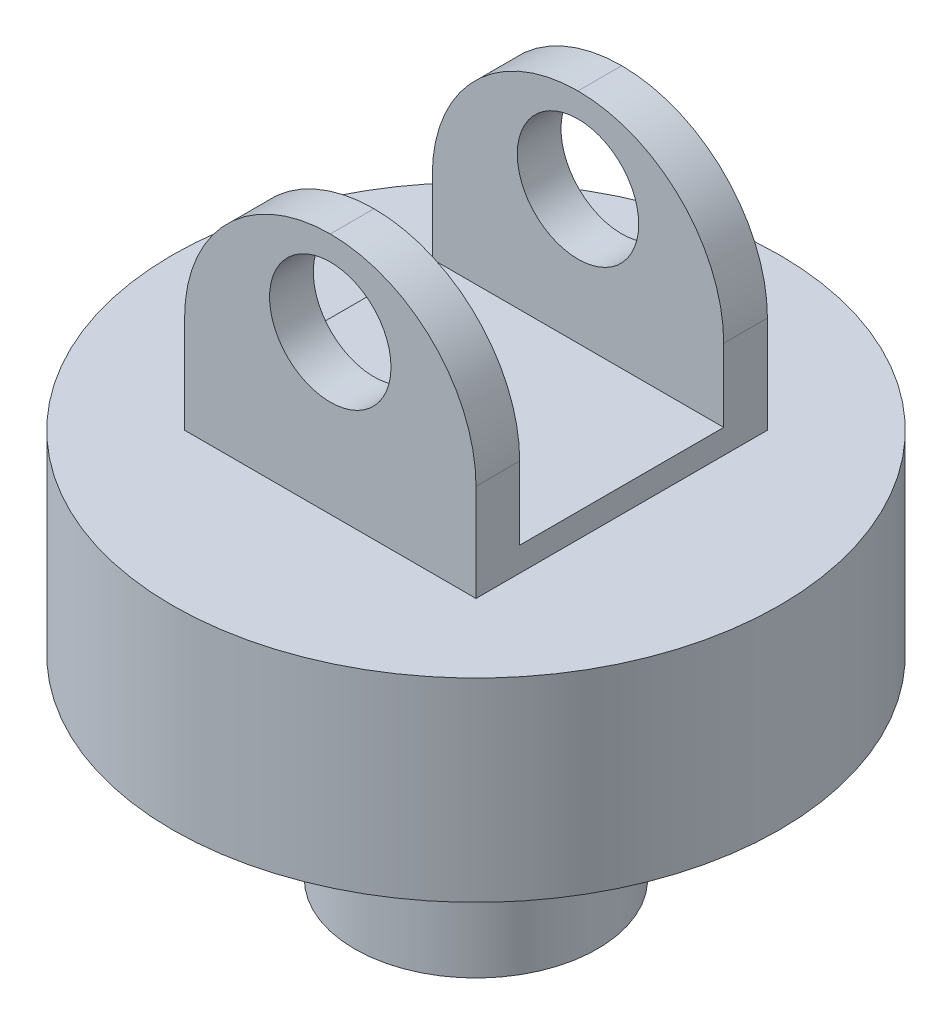
from build123d import *

# Parameters (mm, degrees)
SKETCH1_R           = 125
BOSS_EXTRUDE1_DEPTH = 80
SKETCH2_R           = 50
BOSS_EXTRUDE2_DEPTH = 160
SKETCH3_W           = 120
SKETCH3_H           = 120
BOSS_EXTRUDE3_DEPTH = 100
SKETCH4_W           = 120
SKETCH4_H           = 84
CUT_EXTRUDE1_DEPTH  = 90
FILLET1_R           = 60
SKETCH5_R           = 25
CUT_EXTRUDE2_DEPTH  = 130


with BuildPart() as part:
    # Sketch1 → Boss-Extrude1 (new body)
    with BuildSketch(Plane(origin=(0, 0, 0), x_dir=(1, 0, 0), z_dir=(0, 1, 0))):
        with Locations(Location((0, 0, 0), (0, 0, 270))):
            Circle(SKETCH1_R)
    extrude(amount=BOSS_EXTRUDE1_DEPTH)

    # Sketch2 → Boss-Extrude2 (add)
    with BuildSketch(Plane(origin=(0, 80, 0), x_dir=(1, 0, 0), z_dir=(0, 1, 0))):
        with Locations(Location((0, 0, 0), (0, 0, 270))):
            Circle(SKETCH2_R)
    extrude(amount=-BOSS_EXTRUDE2_DEPTH)

    # Sketch3 → Boss-Extrude3 (add)
    with BuildSketch(Plane(origin=(0, 80, 0), x_dir=(1, 0, 0), z_dir=(0, 1, 0))):
        Rectangle(SKETCH3_W, SKETCH3_H)
    extrude(amount=BOSS_EXTRUDE3_DEPTH)

    # Sketch4 → Cut-Extrude1 (cut)
    with BuildSketch(Plane(origin=(0, 180, 0), x_dir=(1, 0, 0), z_dir=(0, 1, 0))):
        Rectangle(SKETCH4_W, SKETCH4_H)
    extrude(amount=-CUT_EXTRUDE1_DEPTH, mode=Mode.SUBTRACT)

    # Fillet1
    fillet1_edges = [part.edges().sort_by_distance(p)[0] for p in [
        (-60, 180, 51),
        (-60, 180, -51),
        (60, 180, -51),
        (60, 180, 51),
    ]]
    fillet(fillet1_edges, radius=FILLET1_R - 0.0001)  # a hair under: the kernel refuses the full size

    # Sketch5 → Cut-Extrude2 (cut)
    with BuildSketch(Plane.XY.offset(60)):
        with Locations((0, 145)):
            Circle(SKETCH5_R)
    extrude(amount=-CUT_EXTRUDE2_DEPTH, mode=Mode.SUBTRACT)


solid = part.part
